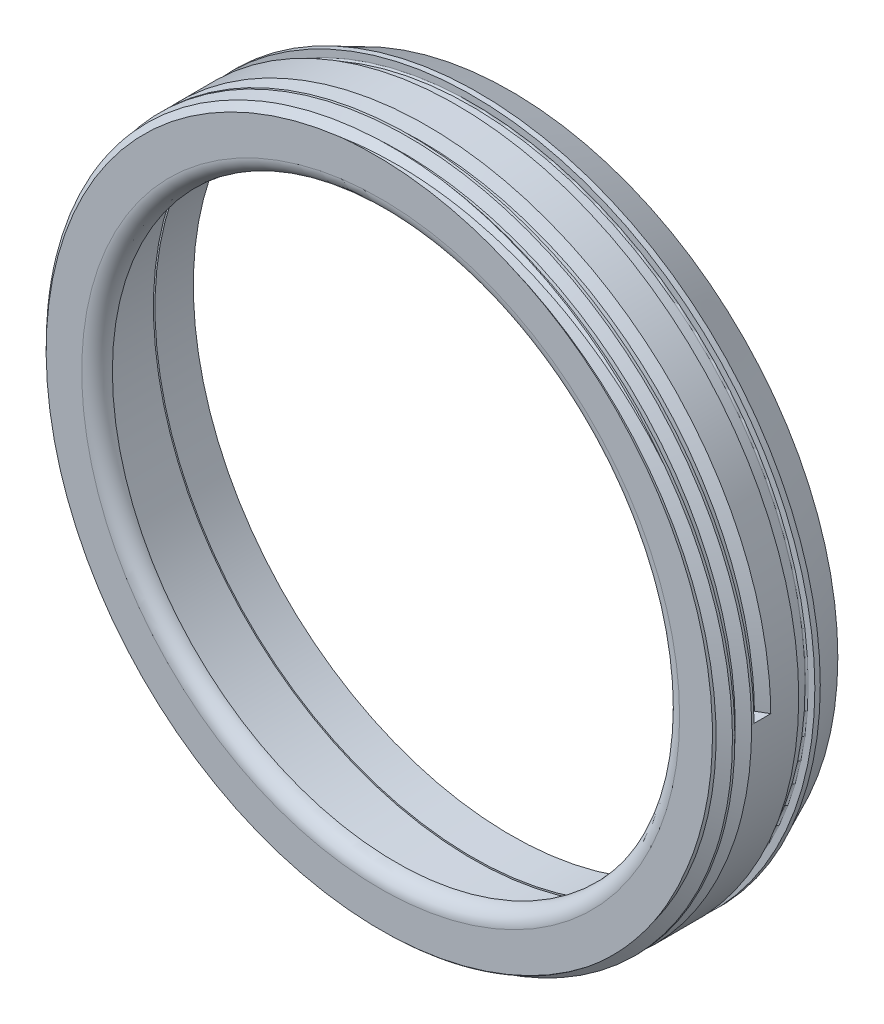
from build123d import *

# Parameters (mm, degrees)
SKETCH1_R           = 56.6928
SKETCH1_R_2         = 52.6288
BOSS_EXTRUDE1_DEPTH = 6.35
SKETCH3_R           = 55.3339
SKETCH3_R_2         = 52.8828
BOSS_EXTRUDE2_DEPTH = 2.667
SKETCH4_R           = 56.6928
SKETCH4_R_2         = 52.8828
BOSS_EXTRUDE3_DEPTH = 10.033
SKETCH18_R          = 56.6928
SKETCH18_R_2        = 46.99
BOSS_EXTRUDE4_DEPTH = 2.54
FILLET1_R           = 0.254
THREAD1_PITCH       = 3.175
FILLET2_R           = 2.54
CHAMFER2_SIZE       = 2.54
CHAMFER2_SIZE2      = 5.447047578


with BuildPart() as part:
    # Sketch1 → Boss-Extrude1 (new body)
    with BuildSketch(Plane.XY):
        with Locations((-54.462846348, 14.706120018)):
            Circle(SKETCH1_R)
        with Locations((-54.462846348, 14.706120018)):
            Circle(SKETCH1_R_2, mode=Mode.SUBTRACT)
    extrude(amount=BOSS_EXTRUDE1_DEPTH)

    # Sketch3 → Boss-Extrude2 (add)
    with BuildSketch(Plane.XY.offset(6.35)):
        with Locations((-54.462846348, 14.706120018)):
            Circle(SKETCH3_R)
        with Locations((-54.462846348, 14.706120018)):
            Circle(SKETCH3_R_2, mode=Mode.SUBTRACT)
    extrude(amount=BOSS_EXTRUDE2_DEPTH)

    # Sketch4 → Boss-Extrude3 (add)
    with BuildSketch(Plane.XY.offset(9.017)):
        with Locations((-54.462846348, 14.706120018)):
            Circle(SKETCH4_R)
        with Locations((-54.462846348, 14.706120018)):
            Circle(SKETCH4_R_2, mode=Mode.SUBTRACT)
    extrude(amount=BOSS_EXTRUDE3_DEPTH)

    # Sketch18 → Boss-Extrude4 (add)
    with BuildSketch(Plane.XY.offset(19.05)):
        with Locations((-54.462846348, 14.706120018)):
            Circle(SKETCH18_R)
        with Locations((-54.462846348, 14.706120018)):
            Circle(SKETCH18_R_2, mode=Mode.SUBTRACT)
    extrude(amount=BOSS_EXTRUDE4_DEPTH)

    # Fillet1
    fillet1_edges = [part.edges().sort_by_distance(p)[0] for p in [
        (-109.796746348, 14.706120018, 6.35),
        (-109.796746348, 14.706120018, 9.017),
    ]]
    fillet(fillet1_edges, radius=FILLET1_R)

    # Thread1: arcs per turn and ends read off the stored shape
    # Thread1: the profile of Thread Profile2 profile screwed along a right-hand helix through 2.5 turns, 12 arcs to a turn; built about Z, then put on its axis
    thread1_z = Axis((0, 0, 0), (0, 0, 1))
    thread1_corners = [(-56.6931, 0, -7.937673205), (-56.6931, 0, -5.159201804), (-54.974280846, 0, -6.151562504), (-54.974280846, 0, -6.945312504)]
    with BuildLine(mode=Mode.PRIVATE) as thread1_profile:
        Line(thread1_corners[0], thread1_corners[1])
        Line(thread1_corners[1], thread1_corners[2])
        Line(thread1_corners[2], thread1_corners[3])
        Line(thread1_corners[3], thread1_corners[0])
    thread1_cap = Face(thread1_profile.wire())
    thread1_turn_angles = [0, 15, 30, 45, 60, 75, 90, 105, 120, 135, 150, 165, 180, 195, 210, 225, 240, 255, 270, 285, 300, 315, 330, 345, 360]
    thread1_turn_weights = [1, 0.9659258262890683, 1, 0.9659258262890683, 1, 0.9659258262890683, 1, 0.9659258262890683, 1, 0.9659258262890683, 1, 0.9659258262890683, 1, 0.9659258262890683, 1, 0.9659258262890683, 1, 0.9659258262890683, 1, 0.9659258262890683, 1, 0.9659258262890683, 1, 0.9659258262890683, 1]
    thread1_turn_rails = [Edge.make_bspline([Vector(p[0], p[1], 0).rotate(thread1_z, thread1_turn_angles[k]) / thread1_turn_weights[k] + Vector(0, 0, p[2] + THREAD1_PITCH * thread1_turn_angles[k] / 360) for k in range(25)], [0, 0, 0, 1, 1, 2, 2, 3, 3, 4, 4, 5, 5, 6, 6, 7, 7, 8, 8, 9, 9, 10, 10, 11, 11, 12, 12, 12], 2, thread1_turn_weights) for p in thread1_corners]
    thread1_turn_sides = [Face.make_surface_from_curves(thread1_turn_rails[p[0]], thread1_turn_rails[p[1]]) for p in [(0, 1), (1, 2), (2, 3), (3, 0)]]
    thread1_last_angles = [720, 735, 750, 765, 780, 795, 810, 825, 840, 855, 870, 885, 900]
    thread1_last_weights = [1, 0.9659258262890683, 1, 0.9659258262890683, 1, 0.9659258262890683, 1, 0.9659258262890683, 1, 0.9659258262890683, 1, 0.9659258262890683, 1]
    thread1_last_rails = [Edge.make_bspline([Vector(p[0], p[1], 0).rotate(thread1_z, thread1_last_angles[k]) / thread1_last_weights[k] + Vector(0, 0, p[2] + THREAD1_PITCH * thread1_last_angles[k] / 360) for k in range(13)], [0, 0, 0, 1, 1, 2, 2, 3, 3, 4, 4, 5, 5, 6, 6, 6], 2, thread1_last_weights) for p in thread1_corners]
    thread1_last_sides = [Face.make_surface_from_curves(thread1_last_rails[p[0]], thread1_last_rails[p[1]]) for p in [(0, 1), (1, 2), (2, 3), (3, 0)]]
    thread1 = Plane(origin=(-54.462846348, 14.706120018, 21.59), x_dir=(-1, 0, 0), z_dir=(0, 0, 1)) * Solid(Shell([*[p.moved(Location((0, 0, THREAD1_PITCH * i))) for i in range(2) for p in thread1_turn_sides], *thread1_last_sides, thread1_cap, thread1_cap.rotate(thread1_z, 900).moved(Location((0, 0, THREAD1_PITCH * 900 / 360)))]))
    add(thread1, mode=Mode.SUBTRACT)

    # Chamfer1: read off the stored shape, not the designer's step
    # Chamfer1 outline → Chamfer1 (revolve, cut)
    with BuildSketch(Plane(origin=(-54.462846348, 14.706120018, 0), x_dir=(1, 0, 0), z_dir=(0, -1, 0))):
        Polygon((56.6928, 21.59), (55.4228, 21.59), (56.6928, 20.32), align=None)
    revolve(axis=Axis((-54.462846348, 14.706120018, 0), (0, 0, 1)), mode=Mode.SUBTRACT)

    # Fillet2
    fillet2_edges = [part.edges().sort_by_distance(p)[0] for p in [
        (-101.452846348, 14.706120018, 21.59),
    ]]
    fillet(fillet2_edges, radius=FILLET2_R - 0.0001)  # a hair under: the kernel refuses the full size

    # Chamfer2
    chamfer2_edges = [part.edges().sort_by_distance(p)[0] for p in [
        (-111.155646348, 14.706120018, 0),
    ]]
    chamfer2_side = [part.faces().sort_by_distance(p)[0] for p in [
        (-109.552131815, 14.706120018, 0),
    ]]
    chamfer(chamfer2_edges, length=CHAMFER2_SIZE, length2=CHAMFER2_SIZE2, reference=chamfer2_side[0])


solid = part.part
